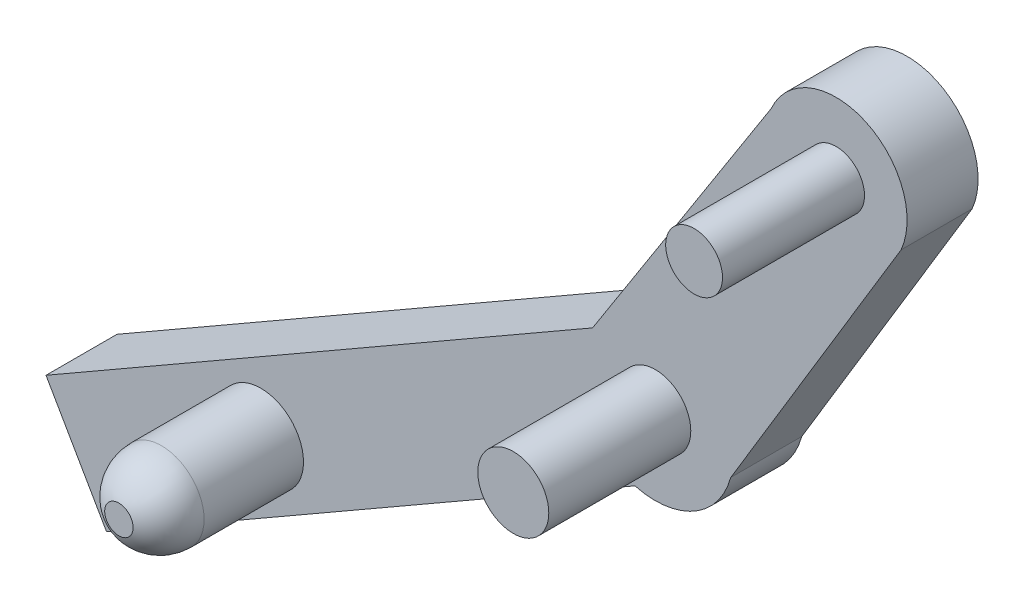
from build123d import *

# Parameters (mm, degrees)
SKETCH1_R             = 2
SKETCH1_R_2           = 2.5
BOSS_EXTRUDE1_DEPTH   = 5
SKETCH6_R             = 3
BOSS_EXTRUDE3_DEPTH   = 10
SKETCH9_R             = 2
BOSS_EXTRUDE4_DEPTH   = 10
SKETCH9_R_2           = 2.5
BOSS_EXTRUDE4_2_DEPTH = 10


with BuildPart() as part:
    # Sketch1 → Boss-Extrude1 (new body)
    with BuildSketch(Plane(origin=(0, 0, 0), x_dir=(0.4985289035363021, -0.866873077410351, 0), z_dir=(0, 0, 1))):
        with BuildLine():
            ThreePointArc((8.899126574, -3.909046337), (10.510039278, -0.019959041), (8.899126574, 3.869128256))
            Line((8.899126574, 3.869128256), (-2.35642803, 24.179978159))
            ThreePointArc((-2.35642803, 24.179978159), (-9.345167797, 25.255857552), (-10.421047189, 18.267117784))
            Line((-10.421047189, 18.267117784), (0.353553391, -2.434608777))
            Line((0.353553391, -2.434608777), (0.353553391, -46.838046337))
            Line((0.353553391, -46.838046337), (8.899126574, -46.838046337))
            Line((8.899126574, -46.838046337), (8.899126574, -3.909046337))
        make_face()
        with Locations((-6.38873761, 21.223547972)):
            Circle(SKETCH1_R, mode=Mode.SUBTRACT)
        with Locations((5.010039278, -0.019959041)):
            Circle(SKETCH1_R_2, mode=Mode.SUBTRACT)
    extrude(amount=BOSS_EXTRUDE1_DEPTH)

    # Sketch6 → Boss-Extrude3 (add)
    with BuildSketch(Plane.XY.offset(5)):
        with Locations((-25.293181008, -19.882635909)):
            Circle(SKETCH6_R)
    extrude(amount=BOSS_EXTRUDE3_DEPTH)

    # Sketch8 → Cut-Revolve9 (revolve, cut)
    with BuildSketch(Plane(origin=(2.306364199, -4.010449578, 0), x_dir=(0.8668730774103515, 0.49852890353630136, 0), z_dir=(0.4985289035363013, -0.8668730774103514, 0))):
        with BuildLine():
            Line((-30.838046337, 15), (-28.838046337, 15))
            Line((-28.838046337, 15), (-28.838046337, 12))
            ThreePointArc((-28.838046337, 12), (-29.383882881, 13.802775638), (-30.838046337, 15))
        make_face()
    revolve(axis=Axis((-25.293181008, -19.882635909, 15), (0, 0, -1)), mode=Mode.SUBTRACT)


with BuildPart() as body_2:
    # Sketch9 → Boss-Extrude4 (new body)
    with BuildSketch(Plane.XY.offset(5)):
        with Locations((15.213151988, 16.118776732)):
            Circle(SKETCH9_R)
    extrude(amount=BOSS_EXTRUDE4_DEPTH)


with BuildPart() as body_3:
    # Sketch9 → Boss-Extrude4 2 (new body)
    with BuildSketch(Plane.XY.offset(5)):
        with Locations((2.480347433, -4.353018325)):
            Circle(SKETCH9_R_2)
    extrude(amount=BOSS_EXTRUDE4_2_DEPTH)


solid = Compound([part.part, body_2.part, body_3.part])
